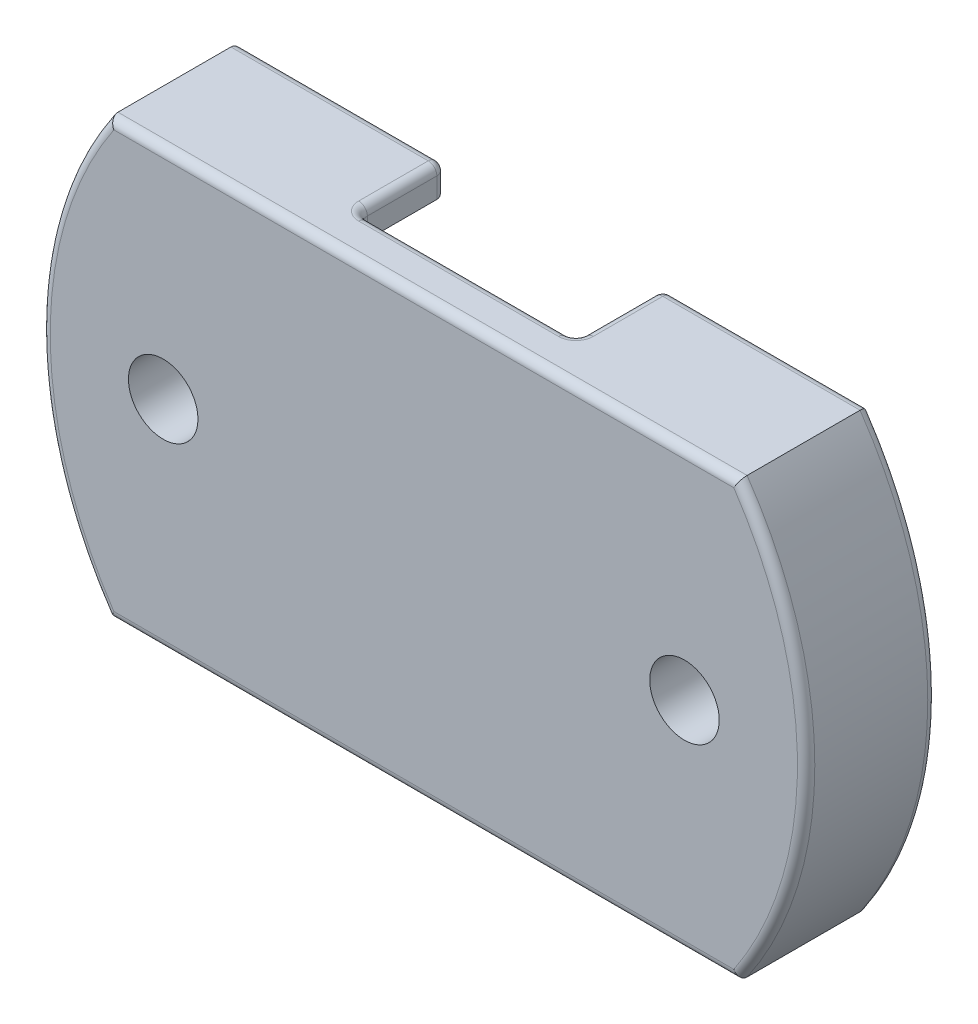
from build123d import *

# Parameters (mm, degrees)
BOSS_EXTRUDE1_DEPTH = 15
CUT_EXTRUDE1_DEPTH  = 10
FILLET1_R           = 1
FILLET2_R           = 1
SKETCH4_R           = 4
CUT_EXTRUDE2_DEPTH  = 53.782573041


with BuildPart() as part:
    # Sketch2 → Boss-Extrude1 (new body)
    with BuildSketch(Plane.XY):
        with BuildLine():
            Line((-36.20773398, 25), (36.20773398, 25))
            ThreePointArc((36.20773398, 25), (44, 0), (36.20773398, -25))
            Line((36.20773398, -25), (-36.20773398, -25))
            ThreePointArc((-36.20773398, -25), (-44, 0), (-36.20773398, 25))
        make_face()
    extrude(amount=BOSS_EXTRUDE1_DEPTH)

    # Sketch3 → Cut-Extrude1 (cut)
    with BuildSketch(Plane.XY):
        with BuildLine():
            Line((12.5, 21.650635095), (12.5, 42.559335642))
            Line((12.5, 42.559335642), (-12.5, 42.559335642))
            Line((-12.5, 42.559335642), (-12.5, 21.650635095))
            ThreePointArc((-12.5, 21.650635095), (-25, 0), (-12.5, -21.650635095))
            Line((-12.5, -21.650635095), (-12.5, -42.559335642))
            Line((-12.5, -42.559335642), (12.5, -42.559335642))
            Line((12.5, -42.559335642), (12.5, -21.650635095))
            ThreePointArc((12.5, -21.650635095), (25, 0), (12.5, 21.650635095))
        make_face()
    extrude(amount=CUT_EXTRUDE1_DEPTH, mode=Mode.SUBTRACT)

    # Fillet1
    fillet1_edges = [part.edges().sort_by_distance(p)[0] for p in [
        (0, -25, 10),
        (0, 25, 10),
        (-24.35386699, 25, 0),
        (-44, 0, 0),
        (-24.35386699, -25, 0),
        (24.35386699, -25, 0),
        (44, 0, 0),
        (24.35386699, 25, 0),
        (12.5, 25, 5),
        (-12.5, 25, 5),
        (-12.5, -25, 5),
        (12.5, -25, 5),
        (-12.5, 23.325317547, 10),
        (-25, 0, 10),
        (-12.5, -23.325317547, 10),
        (12.5, -23.325317547, 10),
        (25, 0, 10),
        (12.5, 23.325317547, 10),
        (-25, 0, 0),
        (-12.5, 23.325317547, 0),
        (-12.5, -23.325317547, 0),
        (12.5, 23.325317547, 0),
        (25, 0, 0),
        (12.5, -23.325317547, 0),
    ]]
    fillet(fillet1_edges, radius=FILLET1_R)

    # Fillet2
    fillet2_edges = [part.edges().sort_by_distance(p)[0] for p in [
        (0, -25, 15),
        (-44, 0, 15),
        (0, 25, 15),
        (44, 0, 15),
    ]]
    fillet(fillet2_edges, radius=FILLET2_R)

    # Sketch4 → Cut-Extrude2 (cut, through all)
    with BuildSketch(Plane.XY.offset(15)):
        with Locations((-30, 0)):
            Circle(SKETCH4_R)
        with Locations((30, 0)):
            Circle(SKETCH4_R)
    extrude(amount=-CUT_EXTRUDE2_DEPTH, mode=Mode.SUBTRACT)


solid = part.part
